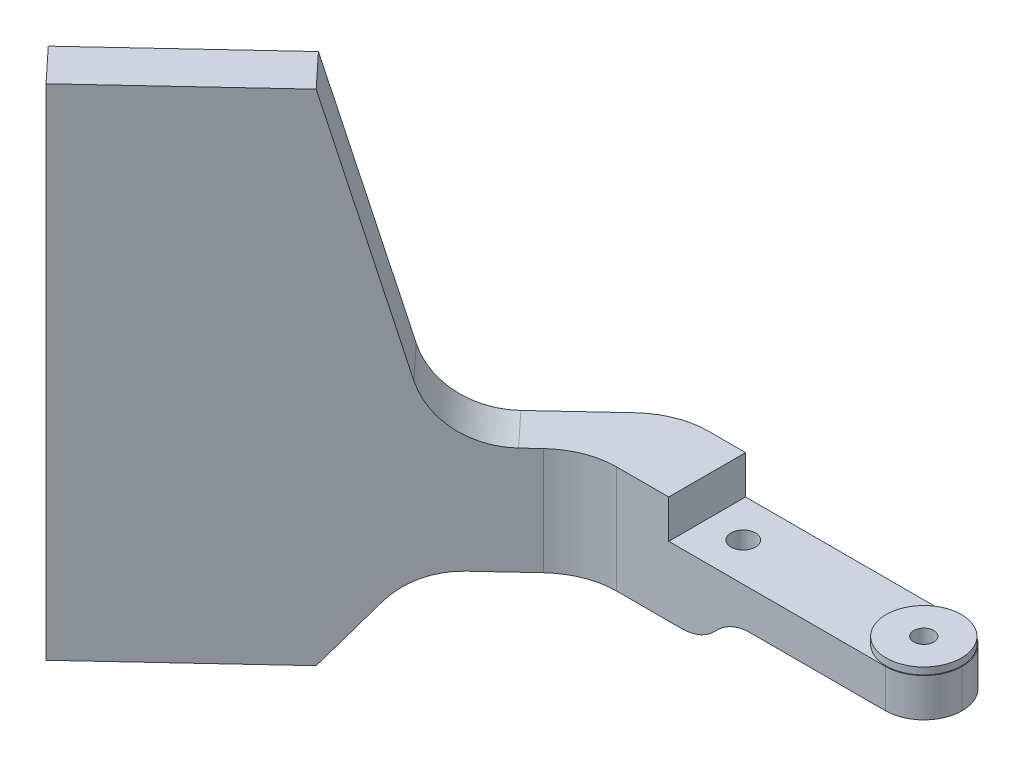
from build123d import *

# Parameters (mm, degrees)
BOSS_EXTRUDE1_DEPTH = 5
FILLET1_R           = 5
SKETCH2_R           = 1.3
CUT_EXTRUDE1_DEPTH  = 10
BOSS_EXTRUDE2_DEPTH = 45
BOSS_EXTRUDE3_DEPTH = 15
BOSS_EXTRUDE4_DEPTH = 6
BOSS_EXTRUDE5_START = -5.9
SKETCH6_R           = 4.9
SKETCH6_R_2         = 1.3
BOSS_EXTRUDE5_DEPTH = 5.9
BOSS_EXTRUDE6_DEPTH = 4
BOSS_EXTRUDE7_DEPTH = 5
BOSS_EXTRUDE8_DEPTH = 9
CHAMFER1_SIZE       = 5
FILLET2_R           = 6
SKETCH11_R          = 1.6
CUT_EXTRUDE2_DEPTH  = 10
FILLET3_R           = 10


# Some blends are built 0.0001 mm under size
with BuildPart() as part:
    # Sketch1 → Boss-Extrude1 (new body)
    with BuildSketch(Plane(origin=(0, 0, 0), x_dir=(1, 0, 0), z_dir=(0, 1, 0))):
        Polygon((4.09199016, 5.61187779), (0, 10), (0, 1.796035233), align=None)
        Polygon((0, 1.796035233), (0, 10), (-42.418514694, -29.555904884), (-38.326524534, -33.944027093), (-1.926011986, 0), align=None)
        Polygon((42, 10), (0, 10), (4.09199016, 5.61187779), (0, 1.796035233), (0, 0), (42, 0), align=None)
        Polygon((0, 0), (0, 1.796035233), (-1.926011986, 0), align=None)
    extrude(amount=BOSS_EXTRUDE1_DEPTH)

    # Fillet1
    fillet1_edges = [part.edges().sort_by_distance(p)[0] for p in [
        (42, 2.5, 0),
        (42, 2.5, -10),
    ]]
    fillet(fillet1_edges, radius=FILLET1_R - 0.0001)  # a hair under: the kernel refuses the full size

    # Sketch2 → Cut-Extrude1 (cut)
    with BuildSketch(Plane(origin=(0, 5, 0), x_dir=(1, 0, 0), z_dir=(0, 1, 0))):
        with Locations(Location((37, 5, 0), (0, 0, 270))):
            Circle(SKETCH2_R)
    extrude(amount=-CUT_EXTRUDE1_DEPTH, mode=Mode.SUBTRACT)

    # Sketch3 → Boss-Extrude2 (add)
    with BuildSketch(Plane(origin=(0, 5, 0), x_dir=(1, 0, 0), z_dir=(0, 1, 0))):
        Polygon((-42.418514694, -29.555904884), (-38.326524534, -33.944027093), (-20.12626826, -16.972013547), (-24.21825842, -12.583891337), align=None)
    extrude(amount=BOSS_EXTRUDE2_DEPTH)

    # Sketch4 → Boss-Extrude3 (add)
    with BuildSketch(Plane.XZ):
        Polygon((-42.418514694, 29.555904884), (-38.326524534, 33.944027093), (-20.12626826, 16.972013547), (-24.21825842, 12.583891337), align=None)
    extrude(amount=BOSS_EXTRUDE3_DEPTH)

    # Sketch5 → Boss-Extrude4 (add)
    with BuildSketch(Plane(origin=(-4.987820251, 0, -5.348782369), x_dir=(-0.7313537016191739, 0, 0.6819983600624947), z_dir=(-0.6819983600624948, 0, -0.731353701619174))):
        Polygon((26.294306197, -15), (26.294306197, 0), (13.888976828, 0), align=None)
        Polygon((13.888976828, 5), (26.294306197, 50), (26.294306197, 5), align=None)
    extrude(amount=-BOSS_EXTRUDE4_DEPTH)

    # Sketch6 → Boss-Extrude5 (add)
    with BuildSketch(Plane.XZ.offset(BOSS_EXTRUDE5_START)):
        with Locations(Location((37, -5, 0), (0, 0, 270))):
            Circle(SKETCH6_R)
        with Locations(Location((37, -5, 0), (0, 0, 90))):
            Circle(SKETCH6_R_2, mode=Mode.SUBTRACT)
    extrude(amount=BOSS_EXTRUDE5_DEPTH)

    # Sketch8 → Boss-Extrude6 (add)
    with BuildSketch(Plane.XZ):
        Polygon((0, -10), (-19.681916643, 8.353684194), (-15.589926483, 12.741806404), (8.797675114, -10), align=None)
    extrude(amount=BOSS_EXTRUDE6_DEPTH)

    # Sketch10 → Boss-Extrude7 (add)
    with BuildSketch(Plane(origin=(0, 5, 0), x_dir=(1, 0, 0), z_dir=(0, 1, 0))):
        Polygon((8.797675114, 10), (8.797675114, 0), (-1.926011986, 0), (-16.799617624, -13.869861642), (-20.891607784, -9.481739432), (0, 10), align=None)
    extrude(amount=BOSS_EXTRUDE7_DEPTH)

    # Sketch9 → Boss-Extrude8 (add)
    with BuildSketch(Plane(origin=(0, 5, 0), x_dir=(1, 0, 0), z_dir=(0, 1, 0))):
        Polygon((17.950520425, 10), (8.797675114, 10), (-1.926011986, 0), (8.797675114, 0), (17.950520425, 0), align=None)
    extrude(amount=-BOSS_EXTRUDE8_DEPTH)

    # Chamfer1
    # the kernel refuses this chamfer: 5 mm, written as the material it adds along each edge
    # the kernel refuses this chamfer: 5 mm, written as the material it takes off along each edge
    with BuildSketch(Plane(origin=(17.950520425, -4, 12.85841494), x_dir=(0.027495876610586317, 0.9996219169112968, 0), z_dir=(0, 0, -1))) as chamfer1_2_piece_1_section:
        Polygon((CHAMFER1_SIZE * 0.999621916911, -CHAMFER1_SIZE * 0.0274958766106), (-CHAMFER1_SIZE * 0.0274958766106, -CHAMFER1_SIZE * 0.999621916911), (0, 0), align=None)
    chamfer1_2_piece_1 = extrude(amount=35.71682988, mode=Mode.PRIVATE)
    chamfer1_2_piece_1 = split(chamfer1_2_piece_1, bisect_by=Plane(origin=(16.228298203, 0, -5), z_dir=(0, -1, 0)), keep=Keep.TOP, mode=Mode.PRIVATE)
    add(chamfer1_2_piece_1, mode=Mode.SUBTRACT)

    # Fillet2
    fillet2_edges = [part.edges().sort_by_distance(p)[0] for p in [
        (12.950520425, -4, -5),
        (16.950520425, 0, -5),
    ]]
    fillet(fillet2_edges, radius=FILLET2_R)

    # Sketch11 → Cut-Extrude2 (cut)
    with BuildSketch(Plane(origin=(0, 5, 0), x_dir=(1, 0, 0), z_dir=(0, 1, 0))):
        with Locations(Location((13.5, 5, 0), (0, 0, 270))):
            Circle(SKETCH11_R)
    extrude(amount=-CUT_EXTRUDE2_DEPTH, mode=Mode.SUBTRACT)

    # Fillet3
    fillet3_edges = [part.edges().sort_by_distance(p)[0] for p in [
        (-14.107655737, 10, 7.257584188),
        (-1.926011986, 3, 0),
        (0, 3, -10),
        (-15.518962067, -4, 8.573648632),
    ]]
    fillet(fillet3_edges, radius=FILLET3_R)


solid = part.part
